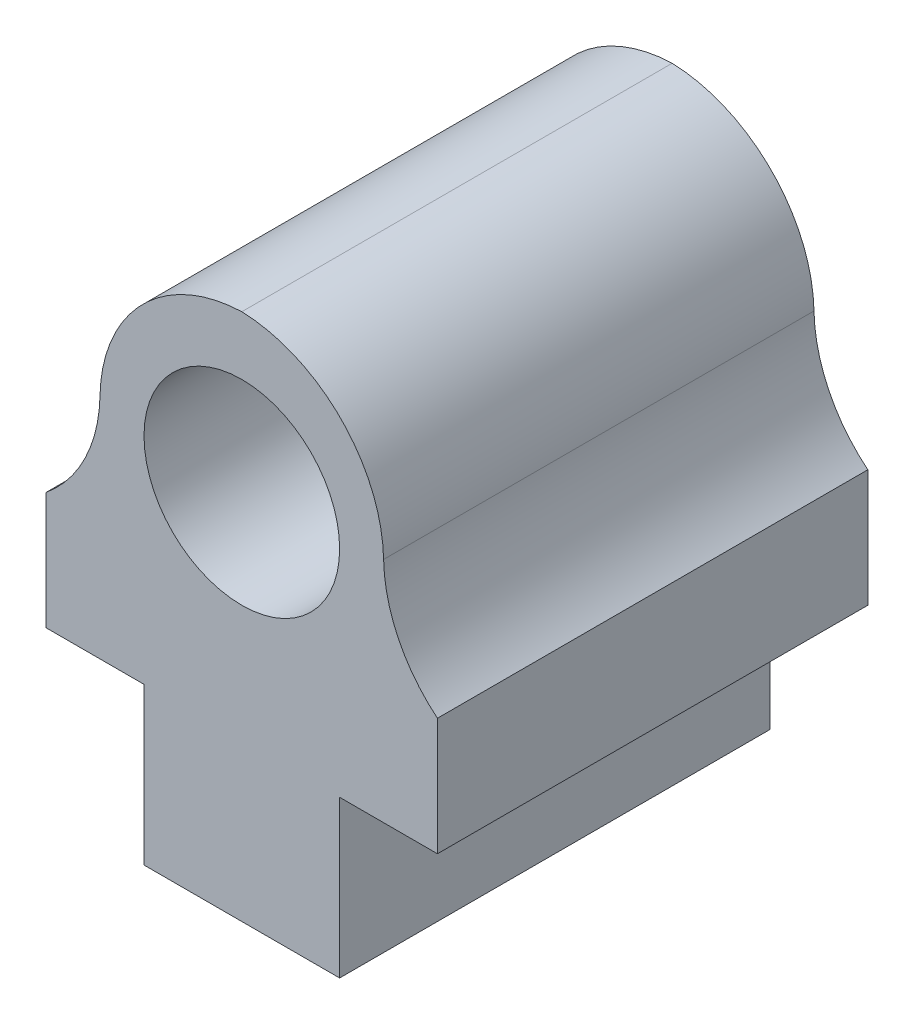
from build123d import *

# Parameters (mm, degrees)
SKETCH6_W           = 20
SKETCH6_H           = 22
BOSS_EXTRUDE5_DEPTH = 6
SKETCH7_W           = 10
SKETCH7_H           = 22
BOSS_EXTRUDE6_DEPTH = 8
SKETCH8_W           = 14.5
SKETCH8_H           = 22
BOSS_EXTRUDE7_DEPTH = 13
SKETCH9_R           = 5
CUT_EXTRUDE1_DEPTH  = 36.284557529
FILLET1_R           = 7.5
FILLET2_R           = 7.5


with BuildPart() as part:
    # Sketch6 → Boss-Extrude5 (new body)
    with BuildSketch(Plane(origin=(0, 0, 0), x_dir=(1, 0, 0), z_dir=(0, 1, 0))):
        with Locations((10, 11)):
            Rectangle(SKETCH6_W, SKETCH6_H)
    extrude(amount=BOSS_EXTRUDE5_DEPTH)

    # Sketch7 → Boss-Extrude6 (add)
    with BuildSketch(Plane.XZ):
        with Locations((10, -11)):
            Rectangle(SKETCH7_W, SKETCH7_H)
    extrude(amount=BOSS_EXTRUDE6_DEPTH)

    # Sketch8 → Boss-Extrude7 (add)
    with BuildSketch(Plane(origin=(0, 6, 0), x_dir=(1, 0, 0), z_dir=(0, 1, 0))):
        with Locations((10, 11)):
            Rectangle(SKETCH8_W, SKETCH8_H)
    extrude(amount=BOSS_EXTRUDE7_DEPTH)

    # Sketch9 → Cut-Extrude1 (cut, through all)
    with BuildSketch(Plane.XY):
        with Locations((10, 11)):
            Circle(SKETCH9_R)
    extrude(amount=-CUT_EXTRUDE1_DEPTH, mode=Mode.SUBTRACT)

    # Fillet1
    # the kernel refuses this fillet: 7.5 mm, written as the material it takes off along each edge
    with BuildSketch(Plane(origin=(17.25, 19, -40.75), x_dir=(-1, 0, 0), z_dir=(0, 0, 1))) as fillet1_piece_1:
        with BuildLine():
            CenterArc((FILLET1_R, FILLET1_R), FILLET1_R, 180, 90)
            Line((0, FILLET1_R), (0, 0))
            Line((0, 0), (FILLET1_R, 0))
        make_face()
    extrude(amount=59.5, mode=Mode.SUBTRACT)
    with BuildSketch(Plane(origin=(2.75, 19, 18.75), x_dir=(0, -1, 0), z_dir=(0, 0, -1))) as fillet1_piece_2:
        with BuildLine():
            CenterArc((FILLET1_R, -FILLET1_R), FILLET1_R, 90, 90)
            Line((0, -FILLET1_R), (0, 0))
            Line((0, 0), (FILLET1_R, 0))
        make_face()
    extrude(amount=59.5, mode=Mode.SUBTRACT)

    # Fillet2
    # the kernel refuses this fillet: 7.5 mm, written as the material it adds along each edge
    with BuildSketch(Plane(origin=(17.25, 6, -22), x_dir=(1, 0, 0), z_dir=(0, 0, 1))) as fillet2_piece_1:
        with BuildLine():
            CenterArc((7.496865043, 5.806657581), FILLET2_R, 181.171427285, 49.563032728)
            Line((-0.001567478, 5.65332879), (-0.75141073, 5.637995911))
            ThreePointArc((-0.75141073, 5.637995911), (-0.75, 5.5), (-0.75, 0))
            Line((-0.75, 0), (0, -0.75))
            ThreePointArc((0, -0.75), (1.375, -0.75), (2.275313496, -0.580665758))
            Line((2.275313496, -0.580665758), (2.75, 0))
        make_face()
    extrude(amount=22)
    with BuildSketch(Plane(origin=(2.75, 6, 0), x_dir=(0.00027726642617420565, 0.9999999615616638, 0), z_dir=(0, 0, -1))) as fillet2_piece_2:
        with BuildLine():
            CenterArc((5.804578729, -7.498474746), FILLET2_R, 91.155541089, 49.563032728)
            Line((-0.000762483, -2.749999894), (-0.581296604, -2.275152409))
            ThreePointArc((-0.581296604, -2.275152409), (-0.750381213, -1.374791997), (-0.749999971, 0.00020795))
            Line((-0.749999971, 0.00020795), (0.00020795, 0.749999971))
            ThreePointArc((0.00020795, 0.749999971), (5.500207738, 0.748475006), (5.638204036, 0.749847475))
            Line((5.638204036, 0.749847475), (5.653329008, 0))
        make_face()
    extrude(amount=22)


solid = part.part
